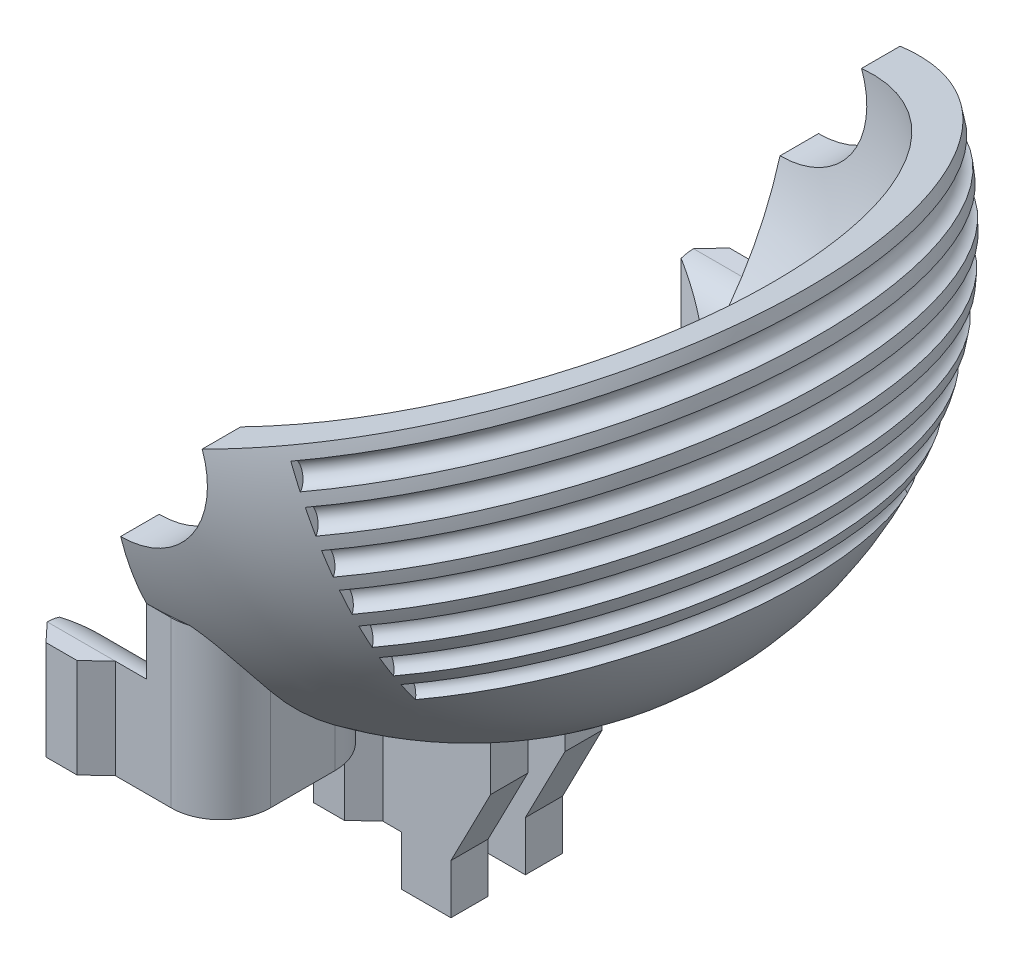
from build123d import *
from OCP.BRepFilletAPI import BRepFilletAPI_MakeChamfer

# Parameters (mm, degrees)
CUT_EXTRUDE1_DEPTH      = 26.114736710152698
CUT_EXTRUDE1_DEPTH_BACK = 26.114736710152698
BOSS_EXTRUDE1_DEPTH     = 4
BOSS_EXTRUDE1_2_DEPTH   = 4
BOSS_EXTRUDE1_3_DEPTH   = 4
BOSS_EXTRUDE1_4_DEPTH   = 4
BOSS_EXTRUDE2_DEPTH     = 2.25
BOSS_EXTRUDE3_DEPTH     = 3
BOSS_EXTRUDE4_DEPTH     = 4
BOSS_EXTRUDE5_DEPTH     = 4
CHAMFER1_SIZE           = 1
CHAMFER1_SIZE2          = 1.8040477552714331
FILLET1_R               = 2
FILLET2_R               = 2
FILLET3_R               = 1.5
CUT_EXTRUDE3_DEPTH      = 10
CUT_REVOLVE1_ANGLE      = 130.00000000000045
BOSS_EXTRUDE6_DEPTH     = 2


# Read off the part's stored shape, not the designer's step: Revolve1
with BuildPart() as part:
    # Revolve1 outline → Revolve1 (revolve)
    with BuildSketch(Plane.YX):
        with BuildLine():
            Line((13, -1.3e-08), (14.5, -1.1e-08))
            ThreePointArc((14.5, -1.1e-08), (10.253048331, 10.253048323), (0, 14.5))
            Line((0, 14.5), (0, 13))
            ThreePointArc((0, 13), (9.19238816, 9.192388151), (13, -1.3e-08))
        make_face()
    revolve(axis=Axis((0, 0, 0), (1, 0, 0)))

    # Sketch7 → Cut-Extrude1 (cut, two sides: drawn at the far end of the back side and taken through both)
    with BuildSketch(Plane.XY.offset(-CUT_EXTRUDE1_DEPTH_BACK)):
        with BuildLine():
            Line((3.288924172750674, 1.1970705016398546), (13.625543001395652, 4.959292078222255))
            ThreePointArc((13.625543001395652, 4.959292078222255), (8.316858327090143, 11.877704642190398), (-1.76e-15, 14.5))
            Line((-1.76e-15, 14.5), (-1.79e-15, -3.04e-15))
            Line((-1.79e-15, -3.04e-15), (-1.58e-15, -3.5))
            ThreePointArc((-1.58e-15, -3.5), (2.867032155011472, -2.0075175272286554), (3.288924172750674, 1.1970705016398546))
        make_face()
    extrude(amount=CUT_EXTRUDE1_DEPTH + CUT_EXTRUDE1_DEPTH_BACK, mode=Mode.SUBTRACT)



with BuildPart() as body_2:
    # Sketch2 → Boss-Extrude1 (new body)
    with BuildSketch(Plane(origin=(0, 0, 0), x_dir=(0, 0, -1), z_dir=(1, 0, 0))):
        Polygon((0.7500000000000001, -15.9783), (2.2499999999999996, -15.9783), (2.2500000000000013, -19.9783), (0.7500000000000009, -19.9783), align=None)
    extrude(amount=-BOSS_EXTRUDE1_DEPTH)


with BuildPart() as body_3:
    # Sketch2 → Boss-Extrude1 2 (new body)
    with BuildSketch(Plane(origin=(0, 0, 0), x_dir=(0, 0, -1), z_dir=(1, 0, 0))):
        Polygon((-0.75, -15.9783), (-2.2499999999999996, -15.9783), (-2.2499999999999996, -19.9783), (-0.7499999999999993, -19.9783), align=None)
    extrude(amount=-BOSS_EXTRUDE1_2_DEPTH)


with BuildPart() as body_4:
    # Sketch2 → Boss-Extrude1 3 (new body)
    with BuildSketch(Plane(origin=(0, 0, 0), x_dir=(0, 0, -1), z_dir=(1, 0, 0))):
        Polygon((-11.532562594670793, -9.000000000000002), (-13.032562594670793, -9.000000000000002), (-13.032562594670793, -13.000000000000004), (-11.532562594670793, -13.000000000000002), align=None)
    extrude(amount=-BOSS_EXTRUDE1_3_DEPTH)


with BuildPart() as body_5:
    # Sketch2 → Boss-Extrude1 4 (new body)
    with BuildSketch(Plane(origin=(0, 0, 0), x_dir=(0, 0, -1), z_dir=(1, 0, 0))):
        Polygon((11.532562594670795, -9.000000000000002), (13.032562594670791, -9.000000000000002), (13.032562594670791, -13.000000000000002), (11.532562594670791, -13.000000000000002), align=None)
    extrude(amount=-BOSS_EXTRUDE1_4_DEPTH)


with BuildPart() as part_1:
    add(part.part)

    add(body_2.part)  # Boss-Extrude2 merges body 2

    add(body_3.part)  # Boss-Extrude2 merges body 3
    # Sketch3 → Boss-Extrude2 (add, symmetric)
    with BuildSketch(Plane.XY):
        Polygon((3.5615528128088356, -15.978300000000004), (1.5, -19.9783), (0, -19.9783), (0, -15.9783), (-2.39e-15, -13), (3.5615528128088223, -13), align=None)
    extrude(amount=BOSS_EXTRUDE2_DEPTH, both=True)


    add(body_4.part)  # Boss-Extrude3 merges body 4

    add(body_5.part)  # Boss-Extrude3 merges body 5
    # Sketch4 → Boss-Extrude3 (add)
    with BuildSketch(Plane(origin=(0, 0, 0), x_dir=(0, 0, -1), z_dir=(1, 0, 0))):
        with BuildLine():
            Line((-6.4226162893325585, -13.000000000000004), (-6.4226162893325585, -11.302654555457316))
            ThreePointArc((-6.4226162893325585, -11.302654555457316), (-9.219278928727187, -9.165418486590061), (-11.340092053595173, -6.356281319764543))
            Line((-11.340092053595173, -6.356281319764543), (-13.032562594670793, -6.356281319764542))
            Line((-13.032562594670793, -6.356281319764542), (-13.032562594670791, -13.000000000000002))
            Line((-13.032562594670791, -13.000000000000002), (-6.4226162893325585, -13.000000000000004))
        make_face()
        with BuildLine():
            Line((11.340092053595173, -6.356281319764543), (13.032562594670793, -6.356281319764542))
            Line((13.032562594670793, -6.356281319764542), (13.032562594670791, -13.000000000000002))
            Line((13.032562594670791, -13.000000000000002), (6.4226162893325585, -13.000000000000004))
            Line((6.4226162893325585, -13.000000000000004), (6.4226162893325585, -11.302654555457316))
            ThreePointArc((6.4226162893325585, -11.302654555457316), (9.219278928727183, -9.165418486590065), (11.340092053595173, -6.356281319764543))
        make_face()
    extrude(amount=BOSS_EXTRUDE3_DEPTH)

    # Sketch5 → Boss-Extrude4 (add)
    with BuildSketch(Plane(origin=(0, -15.9783, 0), x_dir=(1, 0, 0), z_dir=(0, 1, 0))):
        Polygon((-4, -2.25), (-3.3, -2.9983314773547876), (-2.0499999999999963, -2.998331477354794), (-1.250000000000001, -2.2499999999999996), align=None)
        Polygon((-2.0499999999999963, 2.9983314773547933), (-1.250000000000001, 2.2499999999999996), (-4, 2.25), (-3.3000000000000007, 2.9983314773547867), align=None)
    extrude(amount=-BOSS_EXTRUDE4_DEPTH)

    # Sketch6 → Boss-Extrude5 (add)
    with BuildSketch(Plane(origin=(0, -9.000000000000002, 0), x_dir=(1, 0, 0), z_dir=(0, 1, 0))):
        Polygon((-1.2500000000000016, -13.032562594670793), (-2.05, -13.780894072025584), (-3.3000000000000034, -13.780894072025584), (-4, -13.032562594670795), align=None)
        Polygon((-1.2500000000000049, 13.032562594670793), (-2.0500000000000034, 13.780894072025584), (-3.300000000000007, 13.780894072025584), (-4, 13.032562594670795), align=None)
    extrude(amount=-BOSS_EXTRUDE5_DEPTH)

    # Chamfer1: one chamfer whose edges measure the first distance from different faces: ONE call of the kernel's chamfer builder (chamfer() names one face for all edges)
    chamfer1_edges_1 = [part_1.edges().sort_by_distance(p)[0] for p in [
        (-4, -11.000000000000002, 11.532562594670793),
    ]]
    chamfer1_side_1 = [part_1.faces().sort_by_distance(p)[0] for p in [
        (-4, -11.000000000000002, 12.282562594670795),
    ]]
    chamfer1_edges_2 = [part_1.edges().sort_by_distance(p)[0] for p in [
        (-4, -11.000000000000002, -11.532562594670793),
    ]]
    chamfer1_side_2 = [part_1.faces().sort_by_distance(p)[0] for p in [
        (-4, -11.000000000000004, -12.282562594670793),
    ]]
    chamfer1 = BRepFilletAPI_MakeChamfer(part_1.part.solid().wrapped)
    for e in chamfer1_edges_1:
        chamfer1.Add(CHAMFER1_SIZE, CHAMFER1_SIZE2, e.wrapped, chamfer1_side_1[0].wrapped)  # the first distance lies on this face
    for e in chamfer1_edges_2:
        chamfer1.Add(CHAMFER1_SIZE, CHAMFER1_SIZE2, e.wrapped, chamfer1_side_2[0].wrapped)  # the first distance lies on this face
    add(Compound.cast(chamfer1.Shape()), mode=Mode.REPLACE)

    # Fillet1
    fillet1_edges = [part_1.edges().sort_by_distance(p)[0] for p in [
        (3, -9.678140659882272, -13.032562594670793),
        (3, -9.678140659882272, 13.032562594670793),
    ]]
    fillet(fillet1_edges, radius=FILLET1_R)

    # Fillet2
    fillet2_edges = [part_1.edges().sort_by_distance(p)[0] for p in [
        (3, -12.824555321004684, -6.4226162893325585),
        (3, -12.824555321004684, 6.4226162893325585),
    ]]
    fillet(fillet2_edges, radius=FILLET2_R)

    # Fillet3
    fillet3_edges = [part_1.edges().sort_by_distance(p)[0] for p in [
        (-1.0979761223642828, -9.000000000000002, 11.532562594670793),
        (-1.097976122364282, -9.000000000000002, -11.532562594670795),
    ]]
    fillet(fillet3_edges, radius=FILLET3_R)

    # Sketch8 → Cut-Extrude3 (cut)
    with BuildSketch(Plane.XZ.offset(19.9783)):
        with BuildLine():
            Line((0, 0.7499999999999994), (3.1, 0.749999999999999))
            Line((3.1, 0.749999999999999), (3.0999999999999996, 5.25))
            ThreePointArc((3.0999999999999996, 5.25), (3.455702418732044, 5.728725608297927), (4.016712832160874, 5.526315789473686))
            ThreePointArc((4.016712832160874, 5.526315789473686), (5.256968354901936, 2.885951625359105), (5.682456188943444, 1e-17))
            Line((5.682456188943444, 1e-17), (0, 0))
            Line((0, 0), (0, 0.7499999999999994))
        make_face()
    cut_extrude3 = extrude(amount=-CUT_EXTRUDE3_DEPTH, mode=Mode.SUBTRACT)

    # Mirror1: Cut-Extrude3 across plane
    add(cut_extrude3.mirror(Plane.XY), mode=Mode.SUBTRACT)

    # Sketch9 → Cut-Revolve1 (revolve, symmetric, cut)
    with BuildSketch(Plane.XY) as cut_revolve1_sk:
        with BuildLine():
            ThreePointArc((13.788472874762384, 4.48642572455422), (13.93495654907324, 4.008364501319799), (14.06487071500232, 3.525537089617696))
            ThreePointArc((14.06487071500232, 3.525537089617696), (13.454440806001752, 3.870145035757048), (13.788472874762384, 4.48642572455422))
        make_face()
        with BuildLine():
            ThreePointArc((14.181897364194834, 3.020560734606002), (14.277607580598435, 2.529806667403268), (14.356340855764694, 2.0360445066602195))
            ThreePointArc((14.356340855764694, 2.0360445066602195), (13.785276284715724, 2.4425719547342415), (14.181897364194834, 3.020560734606002))
        make_face()
        with BuildLine():
            ThreePointArc((14.419942018352346, 1.5216018491564718), (14.463830155689108, 1.023531742242686), (14.490519921853823, 0.5242445940182665))
            ThreePointArc((14.490519921853823, 0.5242445940182665), (13.965077391699829, 0.9882375442343183), (14.419942018352346, 1.5216018491564718))
        make_face()
        with BuildLine():
            ThreePointArc((14.499998770189928, 0.00597197543192492), (14.49158398084301, -0.49395721087374367), (14.465937819342894, -0.9932990521010843))
            ThreePointArc((14.465937819342894, -0.9932990521010843), (13.99187418840015, -0.47692420360223536), (14.499998770189928, 0.00597197543192492))
        make_face()
        with BuildLine():
            ThreePointArc((14.421190501181444, -1.509723328505564), (14.360564979343833, -2.0060342654210404), (14.282863874891065, -2.4999599059448148))
            ThreePointArc((14.282863874891065, -2.4999599059448148), (13.865373083504398, -1.9368606700616913), (14.421190501181444, -1.509723328505564))
        make_face()
        with BuildLine():
            ThreePointArc((14.184380651213877, -3.00887778772573), (14.072208622789537, -3.496132788766427), (13.943303884944516, -3.9792306759084717))
            ThreePointArc((13.943303884944516, -3.9792306759084717), (13.586960049589903, -3.375576485705514), (14.184380651213877, -3.00887778772573))
        make_face()
        with BuildLine():
            ThreePointArc((13.792163758559106, -4.475066352255412), (13.62967420376496, -4.947926949665264), (13.450978139810571, -5.414904161879316))
            ThreePointArc((13.450978139810571, -5.414904161879316), (13.159685438117902, -4.777308778987149), (13.792163758559106, -4.475066352255412))
        make_face()
    revolve(axis=Axis((0, 0, 0), (-0.3420201433256728, 0.939692620785907, 0)), revolution_arc=CUT_REVOLVE1_ANGLE / 2, mode=Mode.SUBTRACT)
    revolve(cut_revolve1_sk.sketch, axis=Axis((0, 0, 0), (0.3420201433256728, -0.939692620785907, 0)), revolution_arc=CUT_REVOLVE1_ANGLE / 2, mode=Mode.SUBTRACT)

    # Sketch10 → Boss-Extrude6 (add)
    with BuildSketch(Plane.XZ.offset(19.9783)):
        Polygon((1.5, -0.7499999999999992), (-0.5, -0.7499999999999994), (-0.4999999999999998, -2.25), (1.5, -2.25), align=None)
    boss_extrude6 = extrude(amount=BOSS_EXTRUDE6_DEPTH)

    # Mirror2: Boss-Extrude6 across plane
    add(boss_extrude6.mirror(Plane.XY))


solid = part_1.part
